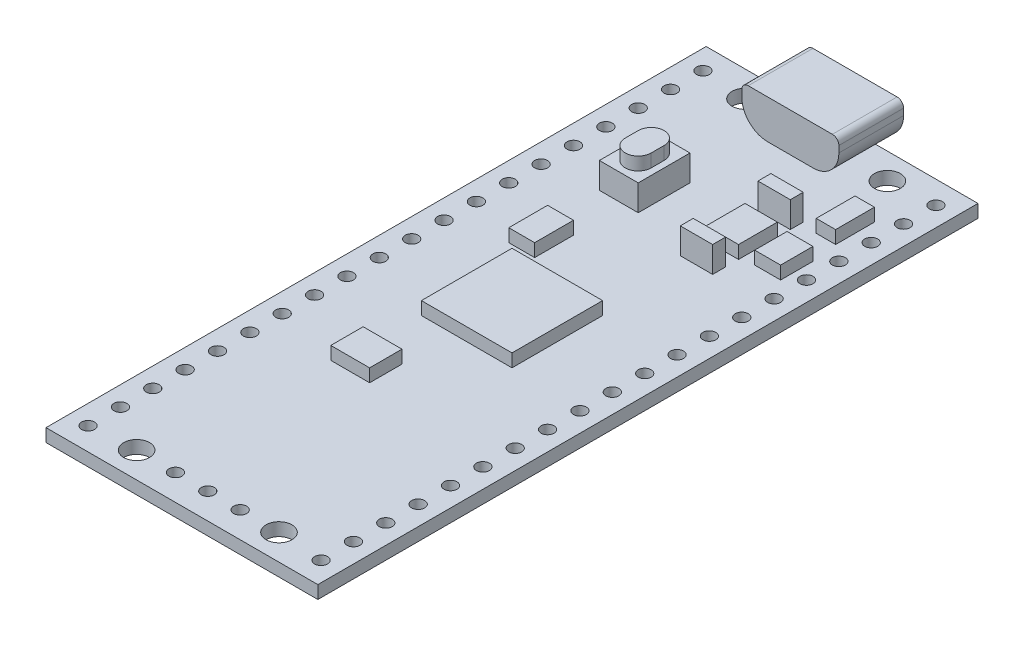
from build123d import *

# Parameters (mm, degrees)
SKETCH1_W           = 21
SKETCH1_H           = 51
TOPFACE_DEPTH       = 1
SKETCH2_R           = 0.5
SKETCH2_R_2         = 1
CUT_EXTRUDE1_DEPTH  = 28.595289453
SKETCH3_W           = 7
SKETCH3_H           = 7
BOSS_EXTRUDE2_DEPTH = 1
SKETCH4_W           = 3
SKETCH4_H           = 4
BOSS_EXTRUDE3_DEPTH = 2
BOSS_EXTRUDE4_DEPTH = 1
SKETCH6_W           = 1.5
SKETCH6_H           = 3
SKETCH6_W_2         = 2
SKETCH6_H_2         = 2.5
SKETCH6_W_3         = 2.5
SKETCH6_W_4         = 3
BOSS_EXTRUDE5_DEPTH = 1
SKETCH7_W           = 2.5
SKETCH7_H           = 1
BOSS_EXTRUDE6_DEPTH = 2
BOSS_EXTRUDE7_DEPTH = 4
BOSS_EXTRUDE8_START = 1
BOSS_EXTRUDE8_DEPTH = 1
CUT_EXTRUDE2_DEPTH  = 4.8
SKETCH11_W          = 3
SKETCH11_H          = 0.2
BOSS_EXTRUDE9_DEPTH = 3


with BuildPart() as part:
    # Sketch1 → TopFace (new body)
    with BuildSketch(Plane(origin=(0, 0, 0), x_dir=(1, 0, 0), z_dir=(0, 1, 0))):
        Rectangle(SKETCH1_W, SKETCH1_H)
    extrude(amount=TOPFACE_DEPTH)

    # Sketch2 → Cut-Extrude1 (cut, through all)
    with BuildSketch(Plane(origin=(0, 1, 0), x_dir=(1, 0, 0), z_dir=(0, 1, 0))):
        with Locations((-9, 23.75)):
            Circle(SKETCH2_R)
        with Locations((-9, 21.25)):
            Circle(SKETCH2_R)
        with Locations((-9, 18.75)):
            Circle(SKETCH2_R)
        with Locations((-9, 16.25)):
            Circle(SKETCH2_R)
        with Locations((-9, 13.75)):
            Circle(SKETCH2_R)
        with Locations((-9, 11.25)):
            Circle(SKETCH2_R)
        with Locations((-9, 8.75)):
            Circle(SKETCH2_R)
        with Locations((-9, 6.25)):
            Circle(SKETCH2_R)
        with Locations((-9, 3.75)):
            Circle(SKETCH2_R)
        with Locations((-9, 1.25)):
            Circle(SKETCH2_R)
        with Locations((-9, -1.25)):
            Circle(SKETCH2_R)
        with Locations((-9, -3.75)):
            Circle(SKETCH2_R)
        with Locations((-9, -6.25)):
            Circle(SKETCH2_R)
        with Locations((-9, -8.75)):
            Circle(SKETCH2_R)
        with Locations((-9, -11.25)):
            Circle(SKETCH2_R)
        with Locations((-9, -13.75)):
            Circle(SKETCH2_R)
        with Locations((-9, -16.25)):
            Circle(SKETCH2_R)
        with Locations((-9, -18.75)):
            Circle(SKETCH2_R)
        with Locations((-9, -21.25)):
            Circle(SKETCH2_R)
        with Locations((-9, -23.75)):
            Circle(SKETCH2_R)
        with Locations((9, -23.75)):
            Circle(SKETCH2_R)
        with Locations((9, -21.25)):
            Circle(SKETCH2_R)
        with Locations((9, -18.75)):
            Circle(SKETCH2_R)
        with Locations((9, -16.25)):
            Circle(SKETCH2_R)
        with Locations((9, -13.75)):
            Circle(SKETCH2_R)
        with Locations((9, -11.25)):
            Circle(SKETCH2_R)
        with Locations((9, -8.75)):
            Circle(SKETCH2_R)
        with Locations((9, -6.25)):
            Circle(SKETCH2_R)
        with Locations((9, -3.75)):
            Circle(SKETCH2_R)
        with Locations((9, -1.25)):
            Circle(SKETCH2_R)
        with Locations((9, 1.25)):
            Circle(SKETCH2_R)
        with Locations((9, 3.75)):
            Circle(SKETCH2_R)
        with Locations((9, 6.25)):
            Circle(SKETCH2_R)
        with Locations((9, 8.75)):
            Circle(SKETCH2_R)
        with Locations((9, 11.25)):
            Circle(SKETCH2_R)
        with Locations((9, 13.75)):
            Circle(SKETCH2_R)
        with Locations((9, 16.25)):
            Circle(SKETCH2_R)
        with Locations((9, 18.75)):
            Circle(SKETCH2_R)
        with Locations((9, 21.25)):
            Circle(SKETCH2_R)
        with Locations((9, 23.75)):
            Circle(SKETCH2_R)
        with Locations((0, -23.5)):
            Circle(SKETCH2_R)
        with Locations((-2.5, -23.5)):
            Circle(SKETCH2_R)
        with Locations((2.5, -23.5)):
            Circle(SKETCH2_R)
        with Locations((-5.5, -23.5)):
            Circle(SKETCH2_R_2)
        with Locations((5.5, -23.5)):
            Circle(SKETCH2_R_2)
        with Locations((-5.5, 23.5)):
            Circle(SKETCH2_R_2)
        with Locations((5.5, 23.5)):
            Circle(SKETCH2_R_2)
    extrude(amount=-CUT_EXTRUDE1_DEPTH, mode=Mode.SUBTRACT)

    # Sketch3 → Boss-Extrude2 (add)
    with BuildSketch(Plane(origin=(0, 1, 0), x_dir=(1, 0, 0), z_dir=(0, 1, 0))):
        Rectangle(SKETCH3_W, SKETCH3_H)
    extrude(amount=BOSS_EXTRUDE2_DEPTH)

    # Sketch4 → Boss-Extrude3 (add)
    with BuildSketch(Plane(origin=(0, 1, 0), x_dir=(1, 0, 0), z_dir=(0, 1, 0))):
        with Locations((-3.5, 13.75)):
            Rectangle(SKETCH4_W, SKETCH4_H)
    extrude(amount=BOSS_EXTRUDE3_DEPTH)

    # Sketch5 → Boss-Extrude4 (add)
    with BuildSketch(Plane(origin=(0, 3, 0), x_dir=(1, 0, 0), z_dir=(0, 1, 0))):
        with BuildLine():
            Line((-2.5, 14.25), (-2.5, 13.25))
            ThreePointArc((-2.5, 13.25), (-3.5, 12.25), (-4.5, 13.25))
            Line((-4.5, 13.25), (-4.5, 14.25))
            ThreePointArc((-4.5, 14.25), (-3.5, 15.25), (-2.5, 14.25))
        make_face()
    extrude(amount=BOSS_EXTRUDE4_DEPTH)

    # Sketch6 → Boss-Extrude5 (add)
    with BuildSketch(Plane(origin=(0, 1, 0), x_dir=(1, 0, 0), z_dir=(0, 1, 0))):
        with Locations((7, 18.75)):
            Rectangle(SKETCH6_W, SKETCH6_H)
        with Locations((7, 14)):
            Rectangle(SKETCH6_W_2, SKETCH6_H_2)
        with Locations((3.75, 14)):
            Rectangle(SKETCH6_W_3, SKETCH6_H)
        with Locations((-4, 6.25)):
            Rectangle(SKETCH6_W_2, SKETCH6_H)
        with Locations((-2.5, -8.75)):
            Rectangle(SKETCH6_W_4, SKETCH6_H_2)
    extrude(amount=BOSS_EXTRUDE5_DEPTH)

    # Sketch7 → Boss-Extrude6 (add)
    with BuildSketch(Plane(origin=(0, 1, 0), x_dir=(1, 0, 0), z_dir=(0, 1, 0))):
        with Locations((3.75, 17)):
            Rectangle(SKETCH7_W, SKETCH7_H)
        with Locations((3.75, 11)):
            Rectangle(SKETCH7_W, SKETCH7_H)
    extrude(amount=BOSS_EXTRUDE6_DEPTH)

    # Sketch8 → Boss-Extrude7 (add)
    with BuildSketch(Plane(origin=(0, 0, -25.5), x_dir=(-1, 0, 0), z_dir=(0, 0, -1))):
        with BuildLine():
            Line((-3.25, 4), (3.25, 4))
            ThreePointArc((3.25, 4), (3.603553391, 3.853553391), (3.75, 3.5))
            Line((3.75, 3.5), (3.75, 3))
            ThreePointArc((3.75, 3), (3.164213562, 1.585786438), (1.75, 1))
            Line((1.75, 1), (-1.75, 1))
            ThreePointArc((-1.75, 1), (-3.164213562, 1.585786438), (-3.75, 3))
            Line((-3.75, 3), (-3.75, 3.5))
            ThreePointArc((-3.75, 3.5), (-3.603553391, 3.853553391), (-3.25, 4))
        make_face()
    extrude(amount=-BOSS_EXTRUDE7_DEPTH)

    # Sketch9 → Boss-Extrude8 (add)
    with BuildSketch(Plane(origin=(0, 0, -25.5), x_dir=(-1, 0, 0), z_dir=(0, 0, -1)).offset(BOSS_EXTRUDE8_START)):
        with BuildLine():
            Line((-1.75, 1), (1.75, 1))
            ThreePointArc((1.75, 1), (3.164213562, 1.585786438), (3.75, 3))
            Line((3.75, 3), (3.75, 3.5))
            ThreePointArc((3.75, 3.5), (3.603553391, 3.853553391), (3.25, 4))
            Line((3.25, 4), (-3.25, 4))
            ThreePointArc((-3.25, 4), (-3.603553391, 3.853553391), (-3.75, 3.5))
            Line((-3.75, 3.5), (-3.75, 3))
            ThreePointArc((-3.75, 3), (-3.164213562, 1.585786438), (-1.75, 1))
        make_face()
    extrude(amount=-BOSS_EXTRUDE8_DEPTH)

    # Sketch10 → Cut-Extrude2 (cut)
    with BuildSketch(Plane(origin=(0, 0, -26.5), x_dir=(-1, 0, 0), z_dir=(0, 0, -1))):
        with BuildLine():
            Line((3.25, 3.9), (-3.25, 3.9))
            ThreePointArc((-3.25, 3.9), (-3.532842712, 3.782842712), (-3.65, 3.5))
            Line((-3.65, 3.5), (-3.65, 3))
            ThreePointArc((-3.65, 3), (-3.093502884, 1.656497116), (-1.75, 1.1))
            Line((-1.75, 1.1), (1.75, 1.1))
            ThreePointArc((1.75, 1.1), (3.093502884, 1.656497116), (3.65, 3))
            Line((3.65, 3), (3.65, 3.5))
            ThreePointArc((3.65, 3.5), (3.532842712, 3.782842712), (3.25, 3.9))
        make_face()
    extrude(amount=-CUT_EXTRUDE2_DEPTH, mode=Mode.SUBTRACT)

    # Sketch11 → Boss-Extrude9 (add)
    with BuildSketch(Plane(origin=(0, 0, -21.7), x_dir=(-1, 0, 0), z_dir=(0, 0, -1))):
        with Locations((0, 3.15)):
            Rectangle(SKETCH11_W, SKETCH11_H)
    extrude(amount=BOSS_EXTRUDE9_DEPTH)


solid = part.part
